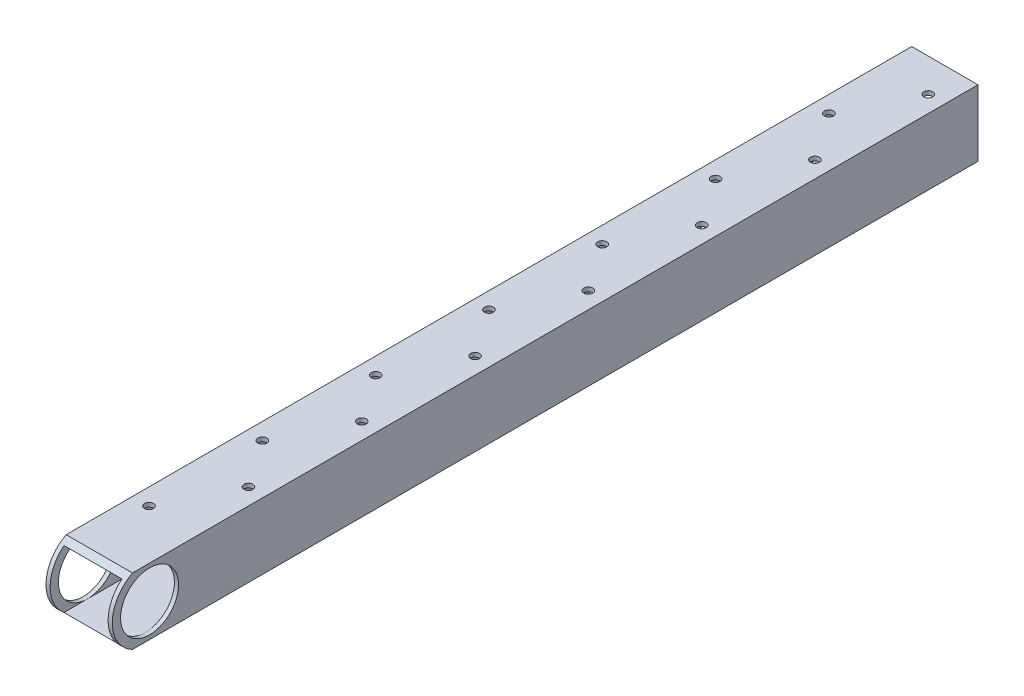
from build123d import *

# Parameters (mm, degrees)
SKETCH1_W                        = 25.4
SKETCH1_H                        = 25.4
SKETCH1_W_2                      = 22.225
SKETCH1_H_2                      = 22.225
EXTRUDE_THIN1_DEPTH              = 168.275
SKETCH2_R                        = 11.1125
CUT_EXTRUDE1_DEPTH               = 171.65440406
CUT_EXTRUDE2_DEPTH               = 171.65440406
F_1_8_0_135_DIAMETER_HOLE2_D     = 3.429
F_1_8_0_135_DIAMETER_HOLE2_DEPTH = 16.51
F_1_8_0_135_DIAMETER_HOLE2_TIP   = 1.030175531
F_1_8_0_135_DIAMETER_HOLE3_D     = 3.429
F_1_8_0_135_DIAMETER_HOLE3_DEPTH = 3.429
F_1_8_0_135_DIAMETER_HOLE3_TIP   = 1.030175531


with BuildPart() as part:
    # Sketch1 → Extrude-Thin1 (new, symmetric)
    with BuildSketch(Plane.XY):
        Rectangle(SKETCH1_W, SKETCH1_H)
        Rectangle(SKETCH1_W_2, SKETCH1_H_2, mode=Mode.SUBTRACT)
    extrude(amount=EXTRUDE_THIN1_DEPTH, both=True)

    # Sketch2 → Cut-Extrude1 (cut, through all)
    with BuildSketch(Plane(origin=(12.7, 0, 0), x_dir=(0, 0, -1), z_dir=(1, 0, 0))):
        with Locations((-149.225, 0)):
            Circle(SKETCH2_R)
    extrude(amount=-CUT_EXTRUDE1_DEPTH, mode=Mode.SUBTRACT)

    # Sketch3 → Cut-Extrude2 (cut, through all)
    with BuildSketch(Plane(origin=(12.7, 0, 0), x_dir=(0, 0, -1), z_dir=(1, 0, 0))):
        with BuildLine():
            Line((-149.225, 14.2875), (-168.275, 14.2875))
            Line((-168.275, 14.2875), (-168.275, -12.7))
            Line((-168.275, -12.7), (-155.770430181, -12.7))
            ThreePointArc((-155.770430181, -12.7), (-163.1099542, 3.367596045), (-149.225, 14.2875))
        make_face()
    extrude(amount=-CUT_EXTRUDE2_DEPTH, mode=Mode.SUBTRACT)

    # 1/8 (0.135) Diameter Hole2
    with Locations(Plane.ZY.offset(12.7)):
        with Locations((125.4125, -6.35), (100.0125, 6.35), (82.814583333, -6.35), (57.414583333, 6.35), (40.216666667, -6.35), (14.816666667, 6.35), (-2.38125, -6.35), (-27.78125, 6.35), (-44.979166667, -6.35), (-70.379166667, 6.35), (-87.577083333, -6.35), (-112.977083333, 6.35), (-130.175, -6.35), (-155.575, 6.35)):
            Hole(F_1_8_0_135_DIAMETER_HOLE2_D / 2, depth=F_1_8_0_135_DIAMETER_HOLE2_DEPTH)
            with Locations((0, 0, -(F_1_8_0_135_DIAMETER_HOLE2_DEPTH + F_1_8_0_135_DIAMETER_HOLE2_TIP / 2))):  # 118° drill point
                Cone(0, F_1_8_0_135_DIAMETER_HOLE2_D / 2, F_1_8_0_135_DIAMETER_HOLE2_TIP, mode=Mode.SUBTRACT)

    # 1/8 (0.135) Diameter Hole3
    with Locations(Plane(origin=(0, 12.7, 0), x_dir=(-1, 0, 0), z_dir=(0, 1, 0))):
        with Locations((6.35, 130.370430181), (-6.35, 104.970430181), (6.35, 86.946191817), (-6.35, 61.546191817), (6.35, 43.521953454), (-6.35, 18.121953454), (6.35, 0.09771509), (-6.35, -25.30228491), (6.35, -43.326523273), (-6.35, -68.726523273), (6.35, -86.750761637), (-6.35, -112.150761637), (6.35, -130.175), (-6.35, -155.575)):
            Hole(F_1_8_0_135_DIAMETER_HOLE3_D / 2, depth=F_1_8_0_135_DIAMETER_HOLE3_DEPTH)
            with Locations((0, 0, -(F_1_8_0_135_DIAMETER_HOLE3_DEPTH + F_1_8_0_135_DIAMETER_HOLE3_TIP / 2))):  # 118° drill point
                Cone(0, F_1_8_0_135_DIAMETER_HOLE3_D / 2, F_1_8_0_135_DIAMETER_HOLE3_TIP, mode=Mode.SUBTRACT)


solid = part.part
